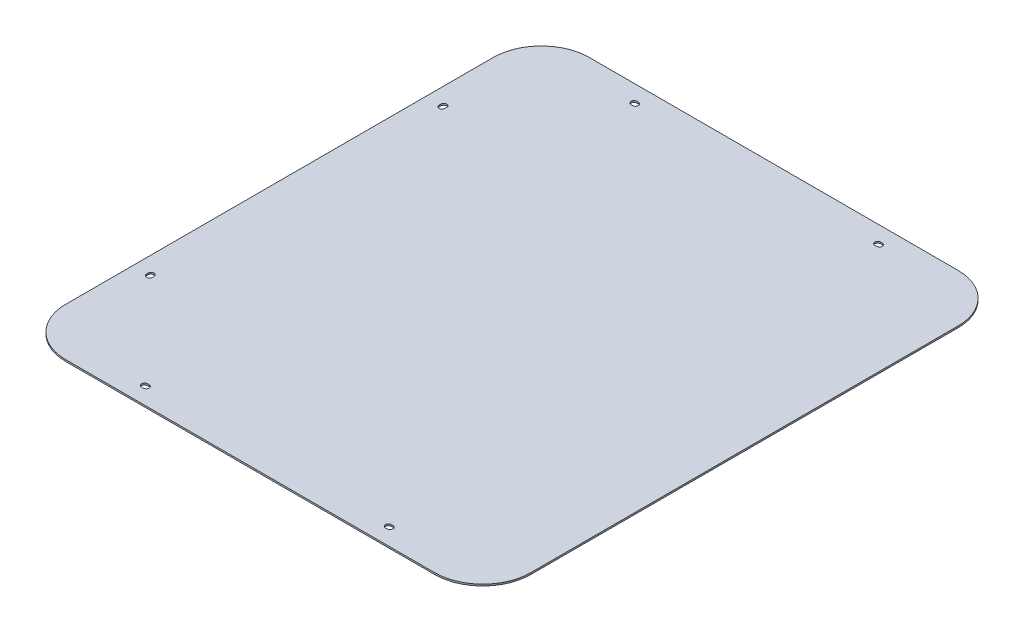
from build123d import *

# Parameters (mm, degrees)
SM_BASE_FLANGE_1_DEPTH = 1
CUT_EXTRUDE_1_DEPTH    = 10
CUT_EXTRUDE_2_DEPTH    = 10


# Sheet-metal steps are written as plain solids
with BuildPart() as part:
    # Sketch 1 → Базовая кромка1 (new body)
    with BuildSketch(Plane(origin=(0, 0, 0), x_dir=(1, 0, 0), z_dir=(0, 1, 0))):
        with BuildLine():
            Line((-113.5, -161), (113.5, -161))
            ThreePointArc((113.5, -161), (134.359650045, -152.359650045), (143, -131.5))
            Line((143, -131.5), (143, 131.5))
            ThreePointArc((143, 131.5), (134.359650045, 152.359650045), (113.5, 161))
            Line((113.5, 161), (-113.5, 161))
            ThreePointArc((-113.5, 161), (-134.359650045, 152.359650045), (-143, 131.5))
            Line((-143, 131.5), (-143, -131.5))
            ThreePointArc((-143, -131.5), (-134.359650045, -152.359650045), (-113.5, -161))
        make_face()
    extrude(amount=-SM_BASE_FLANGE_1_DEPTH)

    # Sketch 2 → Вырез-Вытянуть1 (cut)
    with BuildSketch(Plane(origin=(0, 0, 0), x_dir=(1, 0, 0), z_dir=(0, 1, 0))):
        with BuildLine():
            Line((74.5, -148.7), (75.5, -148.7))
            ThreePointArc((75.5, -148.7), (77.3, -150.5), (75.5, -152.3))
            Line((75.5, -152.3), (74.5, -152.3))
            ThreePointArc((74.5, -152.3), (72.7, -150.5), (74.5, -148.7))
        make_face()
        with BuildLine():
            Line((-74.5, -148.7), (-75.5, -148.7))
            ThreePointArc((-75.5, -148.7), (-77.3, -150.5), (-75.5, -152.3))
            Line((-75.5, -152.3), (-74.5, -152.3))
            ThreePointArc((-74.5, -152.3), (-72.7, -150.5), (-74.5, -148.7))
        make_face()
        with BuildLine():
            Line((74.5, 148.7), (75.5, 148.7))
            ThreePointArc((75.5, 148.7), (77.3, 150.5), (75.5, 152.3))
            Line((75.5, 152.3), (74.5, 152.3))
            ThreePointArc((74.5, 152.3), (72.7, 150.5), (74.5, 148.7))
        make_face()
        with BuildLine():
            Line((-74.5, 148.7), (-75.5, 148.7))
            ThreePointArc((-75.5, 148.7), (-77.3, 150.5), (-75.5, 152.3))
            Line((-75.5, 152.3), (-74.5, 152.3))
            ThreePointArc((-74.5, 152.3), (-72.7, 150.5), (-74.5, 148.7))
        make_face()
    extrude(amount=-CUT_EXTRUDE_1_DEPTH, mode=Mode.SUBTRACT)

    # Эскиз3 → Вырез-Вытянуть2 (cut)
    with BuildSketch(Plane.XZ.offset(1)):
        with BuildLine():
            Line((-134.3, 89.5), (-134.3, 90.5))
            ThreePointArc((-134.3, 90.5), (-132.5, 92.3), (-130.7, 90.5))
            Line((-130.7, 90.5), (-130.7, 89.5))
            ThreePointArc((-130.7, 89.5), (-132.5, 87.7), (-134.3, 89.5))
        make_face()
        with BuildLine():
            Line((-134.3, -89.5), (-134.3, -90.5))
            ThreePointArc((-134.3, -90.5), (-132.5, -92.3), (-130.7, -90.5))
            Line((-130.7, -90.5), (-130.7, -89.5))
            ThreePointArc((-130.7, -89.5), (-132.5, -87.7), (-134.3, -89.5))
        make_face()
    extrude(amount=-CUT_EXTRUDE_2_DEPTH, mode=Mode.SUBTRACT)


solid = part.part
